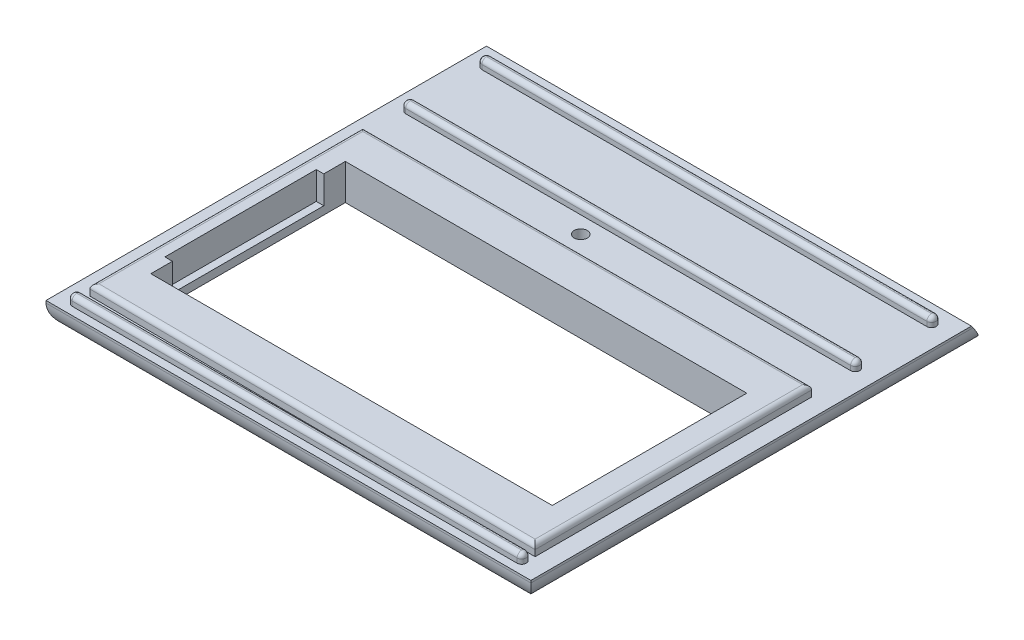
from build123d import *

# Parameters (mm, degrees)
SKETCH1_W           = 106.662693993
SKETCH1_H           = 83.18856
SKETCH1_W_2         = 88.3
SKETCH1_H_2         = 42.78
BOSS_EXTRUDE1_DEPTH = 4
SKETCH1_4_W         = 88.3
SKETCH1_4_H         = 42.78
BOSS_EXTRUDE2_DEPTH = 6.35
SKETCH2_R           = 1.449406475
CUT_EXTRUDE1_DEPTH  = 86.959228837
BOSS_EXTRUDE3_DEPTH = 106.662693993
FILLET6_R           = 1
BOSS_EXTRUDE4_DEPTH = 2
FILLET7_R           = 1
SKETCH5_W           = 1.65
SKETCH5_H           = 33.3
CUT_EXTRUDE3_DEPTH  = 6.08
BOSS_EXTRUDE6_START = 1.5
SKETCH10_W          = 106.662693993
SKETCH10_H          = 93.062075056
SKETCH10_R          = 1.449406475
SKETCH10_W_2        = 88.3
SKETCH10_H_2        = 42.78
BOSS_EXTRUDE6_DEPTH = 1.5
BOSS_EXTRUDE7_DEPTH = 106.662693993
FILLET9_R           = 1
FILLET10_R          = 5


with BuildPart() as part:
    # Sketch1 → Boss-Extrude1 (new body)
    with BuildSketch(Plane(origin=(0, 0, 0), x_dir=(1, 0, 0), z_dir=(0, 1, 0))):
        with Locations((16.325985563, -8.370933327)):
            Rectangle(SKETCH1_W, SKETCH1_H)
        with Locations((15.929638567, -14.302731543)):
            Rectangle(SKETCH1_W_2, SKETCH1_H_2, mode=Mode.SUBTRACT)
    extrude(amount=BOSS_EXTRUDE1_DEPTH)

    # Sketch1<4> → Boss-Extrude2 (add)
    with BuildSketch(Plane(origin=(0, 0, 0), x_dir=(1, 0, 0), z_dir=(0, 1, 0))):
        Polygon((-33.005361433, -44.307731543), (65.60133256, -44.996613327), (65.60133256, 15.853526673), (-33.005361433, 15.702268457), align=None)
        with Locations((15.929638567, -14.302731543)):
            Rectangle(SKETCH1_4_W, SKETCH1_4_H, mode=Mode.SUBTRACT)
    extrude(amount=BOSS_EXTRUDE2_DEPTH)

    # Sketch2 → Cut-Extrude1 (cut, through all)
    with BuildSketch(Plane.XZ):
        with Locations(Location((9.192630415, -21.45022355, 0), (0, 0, 270))):
            Circle(SKETCH2_R)
    extrude(amount=-CUT_EXTRUDE1_DEPTH, mode=Mode.SUBTRACT)

    # Sketch3 → Boss-Extrude3 (add)
    with BuildSketch(Plane.ZY.offset(37.005361433)):
        Polygon((-32.832268457, 0), (-49.732268457, 0), (-46.932268457, 4), (-32.832268457, 4), align=None)
    extrude(amount=-BOSS_EXTRUDE3_DEPTH)

    # Fillet6
    fillet6_edges = [part.edges().sort_by_distance(p)[0] for p in [
        (-33.005361433, 6.35, 14.302731543),
        (16.297985564, 6.35, 44.652172435),
        (65.60133256, 6.35, 14.571543327),
        (16.297985564, 6.35, -15.777897565),
    ]]
    fillet(fillet6_edges, radius=FILLET6_R)

    # Sketch4 → Boss-Extrude4 (add)
    with BuildSketch(Plane(origin=(0, 4, 0), x_dir=(1, 0, 0), z_dir=(0, 1, 0))):
        with BuildLine():
            Line((64.864638567, 25.152939827), (-33.005361433, 25.152939827))
            ThreePointArc((-33.005361433, 25.152939827), (-34.005361433, 26.152939827), (-33.005361433, 27.152939827))
            Line((-33.005361433, 27.152939827), (64.864638567, 27.152939827))
            ThreePointArc((64.864638567, 27.152939827), (65.864638567, 26.152939827), (64.864638567, 25.152939827))
        make_face()
        with BuildLine():
            Line((-33.005361433, 41.932268457), (64.864638567, 41.932268457))
            ThreePointArc((64.864638567, 41.932268457), (65.864638567, 42.932268457), (64.864638567, 43.932268457))
            Line((64.864638567, 43.932268457), (-33.005361433, 43.932268457))
            ThreePointArc((-33.005361433, 43.932268457), (-34.005361433, 42.932268457), (-33.005361433, 41.932268457))
        make_face()
        with BuildLine():
            Line((64.864638567, -48.207731543), (-33.005361433, -48.207731543))
            ThreePointArc((-33.005361433, -48.207731543), (-34.005361433, -47.207731543), (-33.005361433, -46.207731543))
            Line((-33.005361433, -46.207731543), (64.864638567, -46.207731543))
            ThreePointArc((64.864638567, -46.207731543), (65.864638567, -47.207731543), (64.864638567, -48.207731543))
        make_face()
    extrude(amount=BOSS_EXTRUDE4_DEPTH)

    # Fillet7
    fillet7_edges = [part.edges().sort_by_distance(p)[0] for p in [
        (65.864638567, 6, -26.152939827),
        (15.929638567, 6, -27.152939827),
        (-34.005361433, 6, -26.152939827),
        (15.929638567, 6, -25.152939827),
        (65.864638567, 6, 47.207731543),
        (15.929638567, 6, 46.207731543),
        (-34.005361433, 6, 47.207731543),
        (15.929638567, 6, 48.207731543),
        (-34.005361433, 6, -42.932268457),
        (15.929638567, 6, -41.932268457),
        (65.864638567, 6, -42.932268457),
        (15.929638567, 6, -43.932268457),
    ]]
    fillet(fillet7_edges, radius=FILLET7_R - 0.0001)  # a hair under: the kernel refuses the full size

    # Sketch5 → Cut-Extrude3 (cut)
    with BuildSketch(Plane(origin=(0, 6.35, 0), x_dir=(1, 0, 0), z_dir=(0, 1, 0))):
        with Locations((-29.045361433, -14.302731543)):
            Rectangle(SKETCH5_W, SKETCH5_H)
    extrude(amount=-CUT_EXTRUDE3_DEPTH, mode=Mode.SUBTRACT)

    # Sketch10 → Boss-Extrude6 (add)
    with BuildSketch(Plane.XZ.offset(BOSS_EXTRUDE6_START)):
        with Locations((16.325985563, 3.434175799)):
            Rectangle(SKETCH10_W, SKETCH10_H)
        with Locations(Location((9.192630415, -21.45022355, 0), (0, 0, 270))):
            Circle(SKETCH10_R, mode=Mode.SUBTRACT)
        with Locations((15.929638567, 14.302731543)):
            Rectangle(SKETCH10_W_2, SKETCH10_H_2, mode=Mode.SUBTRACT)
    extrude(amount=-BOSS_EXTRUDE6_DEPTH)

    # Sketch11 → Boss-Extrude7 (add)
    with BuildSketch(Plane.ZY.offset(37.005361433)):
        Polygon((-49.732268457, 0), (-50.782268457, -1.5), (-43.096861729, -1.5), (-43.096861729, 0), align=None)
    extrude(amount=-BOSS_EXTRUDE7_DEPTH)

    # Fillet9
    fillet9_edges = [part.edges().sort_by_distance(p)[0] for p in [
        (9.192630415, -1.5, -20.000817075),
    ]]
    fillet(fillet9_edges, radius=FILLET9_R)

    # Fillet10
    fillet10_edges = [part.edges().sort_by_distance(p)[0] for p in [
        (-37.005361433, -1.5, -0.408527565),
        (69.65733256, -1.5, -0.408527565),
        (16.325985564, -1.5, 49.965213327),
    ]]
    fillet(fillet10_edges, radius=FILLET10_R)


solid = part.part
